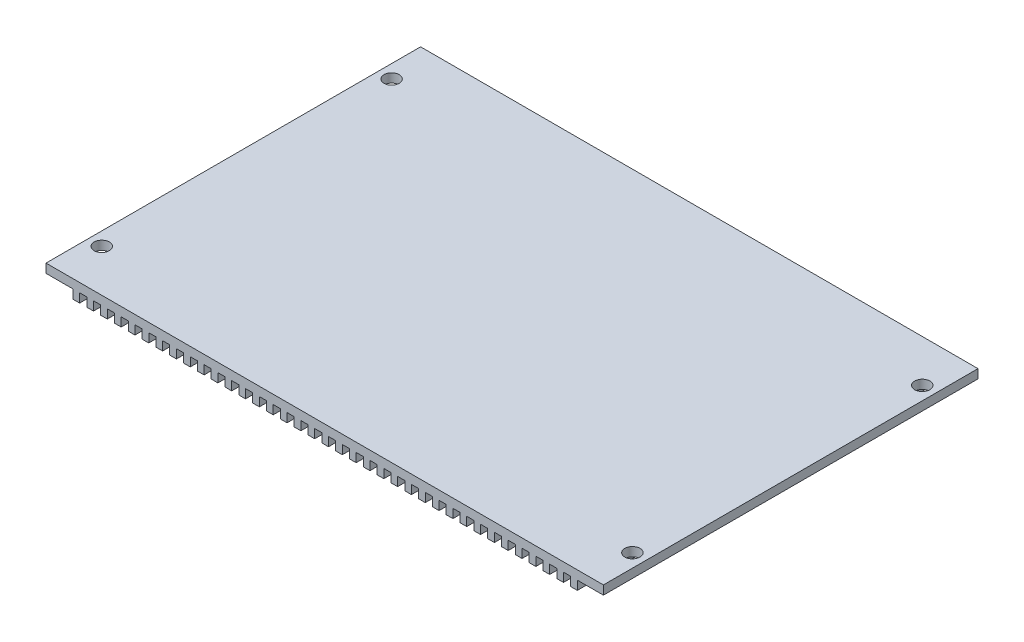
from build123d import *

# Parameters (mm, degrees)
SKETCH1_W               = 125
SKETCH1_H               = 84
BOSS_EXTRUDE1_DEPTH     = 2
M3_CLEARANCE_HOLE1_D    = 3.4
MIRROR2_COPY_1_D        = 3.4
SKETCH4_W               = 1.5
SKETCH4_H               = 84
BOSS_EXTRUDE2_DEPTH     = 2
FILL_START              = -42
FILL_PATTERN2_OUTLINE_W = 1.5
FILL_PATTERN2_OUTLINE_H = 2
FILL_PATTERN2_DEPTH     = 84


# Read off the part's stored shape, not the designer's step: Fill Pattern2
with BuildPart() as part:
    # Sketch1 → Boss-Extrude1 (new body)
    with BuildSketch(Plane(origin=(0, 0, 0), x_dir=(1, 0, 0), z_dir=(0, 1, 0))):
        Rectangle(SKETCH1_W, SKETCH1_H)
    extrude(amount=BOSS_EXTRUDE1_DEPTH)

    # M3 Clearance Hole1 (through all)
    with Locations(Plane(origin=(0, 2, 0), x_dir=(1, 0, 0), z_dir=(0, 1, 0))):
        with Locations((-59.5, 32.5)):
            m3_clearance_hole1 = Hole(M3_CLEARANCE_HOLE1_D / 2)

    # Mirror1: M3 Clearance Hole1 across plane
    add(m3_clearance_hole1.mirror(Plane(origin=(0, 0, 0), x_dir=(0, 0, 1), z_dir=(1, 0, 0))), mode=Mode.SUBTRACT)

    # Mirror2: M3 Clearance Hole1 across plane
    add(m3_clearance_hole1.mirror(Plane.XY), mode=Mode.SUBTRACT)

    # Mirror2 copy 1 (through all)
    with Locations(Plane(origin=(0, 2, 0), x_dir=(-1, 0, 0), z_dir=(0, 1, 0))):
        with Locations((-59.5, 32.5)):
            Hole(MIRROR2_COPY_1_D / 2)

    # Sketch4 → Boss-Extrude2 (add)
    with BuildSketch(Plane(origin=(0, 0, 0), x_dir=(1, 0, 0), z_dir=(0, 1, 0))):
        with Locations((-55.7, 0)):
            Rectangle(SKETCH4_W, SKETCH4_H)
    extrude(amount=-BOSS_EXTRUDE2_DEPTH)

    # Fill Pattern2 outline → Fill Pattern2 (add)
    with BuildSketch(Plane.XY.offset(FILL_START)):
        with Locations((55.9, -1)):
            Rectangle(FILL_PATTERN2_OUTLINE_W, FILL_PATTERN2_OUTLINE_H)
        with Locations((52.8, -1)):
            Rectangle(FILL_PATTERN2_OUTLINE_W, FILL_PATTERN2_OUTLINE_H)
        with Locations((49.7, -1)):
            Rectangle(FILL_PATTERN2_OUTLINE_W, FILL_PATTERN2_OUTLINE_H)
        with Locations((46.6, -1)):
            Rectangle(FILL_PATTERN2_OUTLINE_W, FILL_PATTERN2_OUTLINE_H)
        with Locations((43.5, -1)):
            Rectangle(FILL_PATTERN2_OUTLINE_W, FILL_PATTERN2_OUTLINE_H)
        with Locations((40.4, -1)):
            Rectangle(FILL_PATTERN2_OUTLINE_W, FILL_PATTERN2_OUTLINE_H)
        with Locations((37.3, -1)):
            Rectangle(FILL_PATTERN2_OUTLINE_W, FILL_PATTERN2_OUTLINE_H)
        with Locations((34.2, -1)):
            Rectangle(FILL_PATTERN2_OUTLINE_W, FILL_PATTERN2_OUTLINE_H)
        with Locations((31.1, -1)):
            Rectangle(FILL_PATTERN2_OUTLINE_W, FILL_PATTERN2_OUTLINE_H)
        with Locations((28, -1)):
            Rectangle(FILL_PATTERN2_OUTLINE_W, FILL_PATTERN2_OUTLINE_H)
        with Locations((24.9, -1)):
            Rectangle(FILL_PATTERN2_OUTLINE_W, FILL_PATTERN2_OUTLINE_H)
        with Locations((21.8, -1)):
            Rectangle(FILL_PATTERN2_OUTLINE_W, FILL_PATTERN2_OUTLINE_H)
        with Locations((18.7, -1)):
            Rectangle(FILL_PATTERN2_OUTLINE_W, FILL_PATTERN2_OUTLINE_H)
        with Locations((15.6, -1)):
            Rectangle(FILL_PATTERN2_OUTLINE_W, FILL_PATTERN2_OUTLINE_H)
        with Locations((12.5, -1)):
            Rectangle(FILL_PATTERN2_OUTLINE_W, FILL_PATTERN2_OUTLINE_H)
        with Locations((9.4, -1)):
            Rectangle(FILL_PATTERN2_OUTLINE_W, FILL_PATTERN2_OUTLINE_H)
        with Locations((6.3, -1)):
            Rectangle(FILL_PATTERN2_OUTLINE_W, FILL_PATTERN2_OUTLINE_H)
        with Locations((3.2, -1)):
            Rectangle(FILL_PATTERN2_OUTLINE_W, FILL_PATTERN2_OUTLINE_H)
        with Locations((0.1, -1)):
            Rectangle(FILL_PATTERN2_OUTLINE_W, FILL_PATTERN2_OUTLINE_H)
        with Locations((-3, -1)):
            Rectangle(FILL_PATTERN2_OUTLINE_W, FILL_PATTERN2_OUTLINE_H)
        with Locations((-6.1, -1)):
            Rectangle(FILL_PATTERN2_OUTLINE_W, FILL_PATTERN2_OUTLINE_H)
        with Locations((-9.2, -1)):
            Rectangle(FILL_PATTERN2_OUTLINE_W, FILL_PATTERN2_OUTLINE_H)
        with Locations((-12.3, -1)):
            Rectangle(FILL_PATTERN2_OUTLINE_W, FILL_PATTERN2_OUTLINE_H)
        with Locations((-15.4, -1)):
            Rectangle(FILL_PATTERN2_OUTLINE_W, FILL_PATTERN2_OUTLINE_H)
        with Locations((-18.5, -1)):
            Rectangle(FILL_PATTERN2_OUTLINE_W, FILL_PATTERN2_OUTLINE_H)
        with Locations((-21.6, -1)):
            Rectangle(FILL_PATTERN2_OUTLINE_W, FILL_PATTERN2_OUTLINE_H)
        with Locations((-24.7, -1)):
            Rectangle(FILL_PATTERN2_OUTLINE_W, FILL_PATTERN2_OUTLINE_H)
        with Locations((-27.8, -1)):
            Rectangle(FILL_PATTERN2_OUTLINE_W, FILL_PATTERN2_OUTLINE_H)
        with Locations((-30.9, -1)):
            Rectangle(FILL_PATTERN2_OUTLINE_W, FILL_PATTERN2_OUTLINE_H)
        with Locations((-34, -1)):
            Rectangle(FILL_PATTERN2_OUTLINE_W, FILL_PATTERN2_OUTLINE_H)
        with Locations((-37.1, -1)):
            Rectangle(FILL_PATTERN2_OUTLINE_W, FILL_PATTERN2_OUTLINE_H)
        with Locations((-40.2, -1)):
            Rectangle(FILL_PATTERN2_OUTLINE_W, FILL_PATTERN2_OUTLINE_H)
        with Locations((-43.3, -1)):
            Rectangle(FILL_PATTERN2_OUTLINE_W, FILL_PATTERN2_OUTLINE_H)
        with Locations((-46.4, -1)):
            Rectangle(FILL_PATTERN2_OUTLINE_W, FILL_PATTERN2_OUTLINE_H)
        with Locations((-49.5, -1)):
            Rectangle(FILL_PATTERN2_OUTLINE_W, FILL_PATTERN2_OUTLINE_H)
        with Locations((-52.6, -1)):
            Rectangle(FILL_PATTERN2_OUTLINE_W, FILL_PATTERN2_OUTLINE_H)
    extrude(amount=FILL_PATTERN2_DEPTH)


solid = part.part
